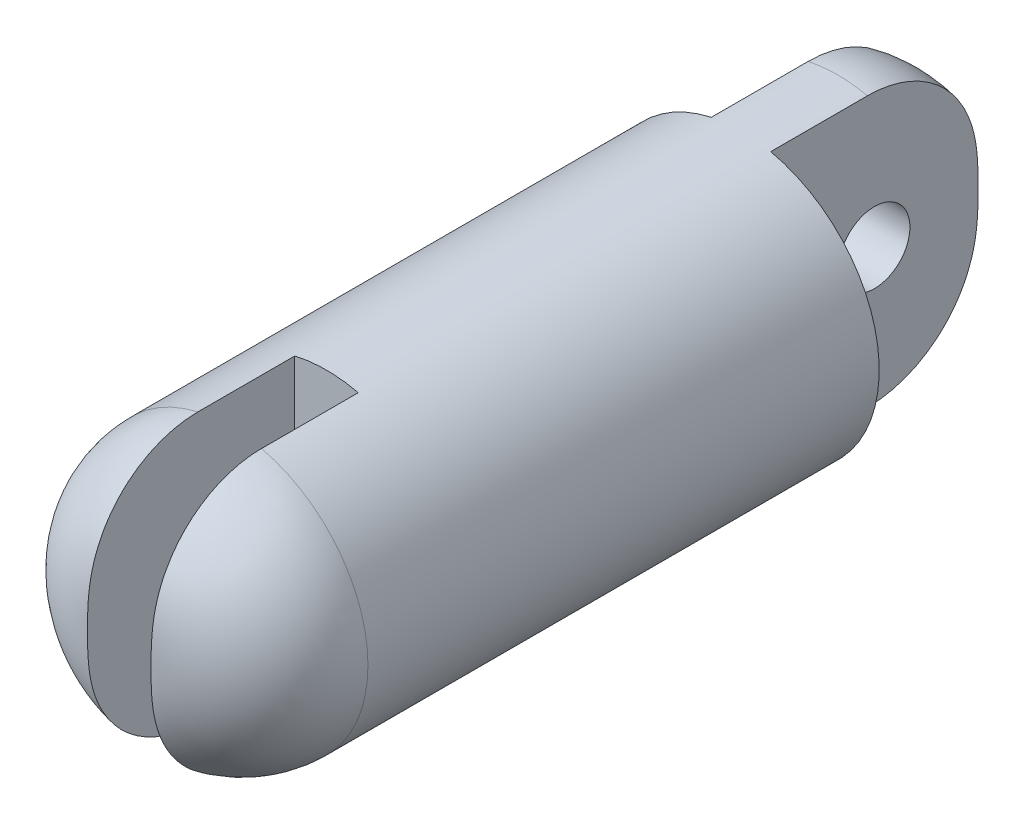
from build123d import *

# Parameters (mm, degrees)
SKETCH1_R           = 100
BOSS_EXTRUDE1_DEPTH = 600
FILLET2_R           = 80
SKETCH2_W           = 46
SKETCH2_H           = 231.861905776
CUT_EXTRUDE1_DEPTH  = 150
SKETCH3_R           = 20.155129503
BOSS_EXTRUDE2_DEPTH = 30
CUT_EXTRUDE2_DEPTH  = 150
FILLET3_R           = 80
SKETCH5_R           = 25.736273229
CUT_EXTRUDE3_DEPTH  = 520


with BuildPart() as part:
    # Sketch1 → Boss-Extrude1 (new body)
    with BuildSketch(Plane.XY):
        Circle(SKETCH1_R)
    extrude(amount=BOSS_EXTRUDE1_DEPTH)

    # Fillet2
    fillet2_edges = [part.edges().sort_by_distance(p)[0] for p in [
        (-100, 0, 600),
    ]]
    fillet(fillet2_edges, radius=FILLET2_R)

    # Sketch2 → Cut-Extrude1 (cut)
    with BuildSketch(Plane.XY.offset(600)):
        Rectangle(SKETCH2_W, SKETCH2_H)
    extrude(amount=-CUT_EXTRUDE1_DEPTH, mode=Mode.SUBTRACT)

    # Sketch3 → Boss-Extrude2 (add, symmetric)
    with BuildSketch(Plane(origin=(0, 0, 0), x_dir=(0, 0, -1), z_dir=(1, 0, 0))):
        with Locations(Location((-524.951093161, 0, 0), (0, 0, 180))):
            Circle(SKETCH3_R)
    extrude(amount=BOSS_EXTRUDE2_DEPTH, both=True)

    # Sketch4 → Cut-Extrude2 (cut)
    with BuildSketch(Plane(origin=(0, 0, 0), x_dir=(-1, 0, 0), z_dir=(0, 0, -1))):
        with BuildLine():
            ThreePointArc((-21.514315111, 97.658252315), (-100, 0), (-21.514315111, -97.658252315))
            Line((-21.514315111, -97.658252315), (-21.514315111, 97.658252315))
        make_face()
        with BuildLine():
            Line((21.514315111, 97.658252315), (21.514315111, -97.658252315))
            ThreePointArc((21.514315111, -97.658252315), (100, 0), (21.514315111, 97.658252315))
        make_face()
    extrude(amount=-CUT_EXTRUDE2_DEPTH, mode=Mode.SUBTRACT)

    # Fillet3
    # the kernel refuses this fillet: 80 mm, written as the material it takes off along each edge
    with BuildSketch(Plane(origin=(0, 0, 0), x_dir=(-0.7984359735160296, 0.6020797257801578, 0), z_dir=(0.6020797257801578, 0.7984359735160296, 0))) as fillet3_piece_1:
        with BuildLine():
            CenterArc((100 - FILLET3_R, FILLET3_R), FILLET3_R, 270, 90)
            Line((100 - FILLET3_R, 0), (100, 0))
            Line((100, 0), (100, FILLET3_R))
        make_face()
    revolve(axis=Axis((0, 0, 0), (0, 0, 1)), revolution_arc=254.037985384, mode=Mode.SUBTRACT)
    with BuildSketch(Plane(origin=(0, 0, 0), x_dir=(0.79843597351603, -0.6020797257801573, 0), z_dir=(-0.6020797257801573, -0.79843597351603, 0))) as fillet3_piece_2:
        with BuildLine():
            CenterArc((100 - FILLET3_R, FILLET3_R), FILLET3_R, 270, 90)
            Line((100 - FILLET3_R, 0), (100, 0))
            Line((100, 0), (100, FILLET3_R))
        make_face()
    revolve(axis=Axis((0, 0, 0), (0, 0, 1)), revolution_arc=254.037985384, mode=Mode.SUBTRACT)

    # Sketch5 → Cut-Extrude3 (cut)
    with BuildSketch(Plane(origin=(21.514315111, 0, 0), x_dir=(0, 0, -1), z_dir=(1, 0, 0))):
        with Locations((-75, 0)):
            Circle(SKETCH5_R)
    extrude(amount=-CUT_EXTRUDE3_DEPTH, mode=Mode.SUBTRACT)


solid = part.part
